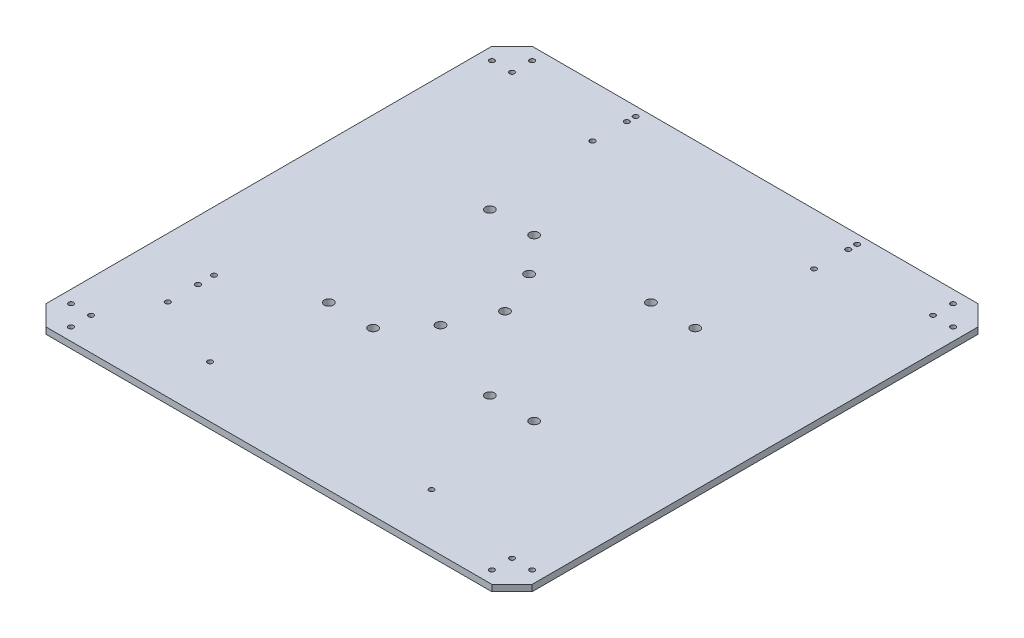
from build123d import *

# Parameters (mm, degrees)
BOSS_EXTRUDE1_DEPTH      = 3.175
SKETCH2_R                = 1.5
SKETCH2_R_2              = 2.25
CUT_EXTRUDE1_DEPTH       = 171.795800958
M3X0_5_TAPPED_HOLE1_D    = 2.5
SKETCH5_R                = 1.25
CUT_EXTRUDE2_DEPTH       = 171.795800958
SKETCH6_R                = 1.25
CUT_EXTRUDE3_DEPTH       = 10
M4_CLEARANCE_HOLE1_D     = 4.5
M4_CLEARANCE_HOLE1_DEPTH = 10
M4_CLEARANCE_HOLE1_TIP   = 1.351936393
M3X0_5_TAPPED_HOLE2_D    = 2.5


with BuildPart() as part:
    # Sketch1 → Boss-Extrude1 (new body)
    with BuildSketch(Plane(origin=(0, 0, 0), x_dir=(1, 0, 0), z_dir=(0, 1, 0))):
        Polygon((-110.75, 120.75), (110.75, 120.75), (120.75, 110.75), (120.75, -110.75), (110.75, -120.75), (-110.75, -120.75), (-120.75, -110.75), (-120.75, 110.75), align=None)
    extrude(amount=BOSS_EXTRUDE1_DEPTH)

    # Sketch2 → Cut-Extrude1 (cut, through all)
    with BuildSketch(Plane(origin=(0, 3.175, 0), x_dir=(1, 0, 0), z_dir=(0, 1, 0))):
        with Locations((-51, -40)):
            Circle(SKETCH2_R)
        with Locations((-29, -40)):
            Circle(SKETCH2_R_2)
        with Locations((-51, 40)):
            Circle(SKETCH2_R)
        with Locations((-29, 40)):
            Circle(SKETCH2_R_2)
        with Locations((29, 40)):
            Circle(SKETCH2_R_2)
        with Locations((51, 40)):
            Circle(SKETCH2_R_2)
        with Locations((29, -40)):
            Circle(SKETCH2_R_2)
        with Locations((51, -40)):
            Circle(SKETCH2_R_2)
        with Locations((-3.5, 0)):
            Circle(SKETCH2_R_2)
        with Locations((-13.5, 22)):
            Circle(SKETCH2_R_2)
        with Locations((-13.5, -22)):
            Circle(SKETCH2_R_2)
    extrude(amount=-CUT_EXTRUDE1_DEPTH, mode=Mode.SUBTRACT)

    # M3x0.5 Tapped Hole1 (through all)
    with Locations(Plane(origin=(0, 3.175, 0), x_dir=(-1, 0, 0), z_dir=(0, 1, 0))):
        with Locations((114.55, -104.55), (104.55, -114.55), (-104.55, -114.55), (-114.55, -104.55), (-114.55, 104.55), (-104.55, 114.55), (104.55, 114.55), (114.55, 104.55), (-104.55, 104.55), (-104.55, -104.55), (104.55, -104.55), (104.55, 104.55)):
            Hole(M3X0_5_TAPPED_HOLE1_D / 2)

    # Sketch5 → Cut-Extrude2 (cut, through all)
    with BuildSketch(Plane(origin=(0, 3.175, 0), x_dir=(1, 0, 0), z_dir=(0, 1, 0))):
        with Locations((-55, 95)):
            Circle(SKETCH5_R)
        with Locations((55, 95)):
            Circle(SKETCH5_R)
        with Locations((-55, -95)):
            Circle(SKETCH5_R)
        with Locations((55, -95)):
            Circle(SKETCH5_R)
    extrude(amount=-CUT_EXTRUDE2_DEPTH, mode=Mode.SUBTRACT)

    # Sketch6 → Cut-Extrude3 (cut)
    with BuildSketch(Plane(origin=(0, 3.175, 0), x_dir=(1, 0, 0), z_dir=(0, 1, 0))):
        with Locations((-91.25, -64.75)):
            Circle(SKETCH6_R)
        with Locations((-91.25, -56.75)):
            Circle(SKETCH6_R)
        with Locations((-91.25, -79.75)):
            Circle(SKETCH6_R)
    extrude(amount=-CUT_EXTRUDE3_DEPTH, mode=Mode.SUBTRACT)

    # M4 Clearance Hole1
    with Locations(Plane(origin=(0, 3.175, 0), x_dir=(-1, 0, 0), z_dir=(0, 1, 0))):
        with Locations((51, -40), (51, 40)):
            Hole(M4_CLEARANCE_HOLE1_D / 2, depth=M4_CLEARANCE_HOLE1_DEPTH)
            with Locations((0, 0, -(M4_CLEARANCE_HOLE1_DEPTH + M4_CLEARANCE_HOLE1_TIP / 2))):  # 118° drill point
                Cone(0, M4_CLEARANCE_HOLE1_D / 2, M4_CLEARANCE_HOLE1_TIP, mode=Mode.SUBTRACT)

    # M3x0.5 Tapped Hole2 (through all)
    with Locations(Plane(origin=(0, 3.175, 0), x_dir=(-1, 0, 0), z_dir=(0, 1, 0))):
        with Locations((-55.188488938, -111.84444349), (54.811511062, -111.84444349), (-55.188488938, -116.267236791), (54.811511062, -116.267236791)):
            Hole(M3X0_5_TAPPED_HOLE2_D / 2)


solid = part.part
